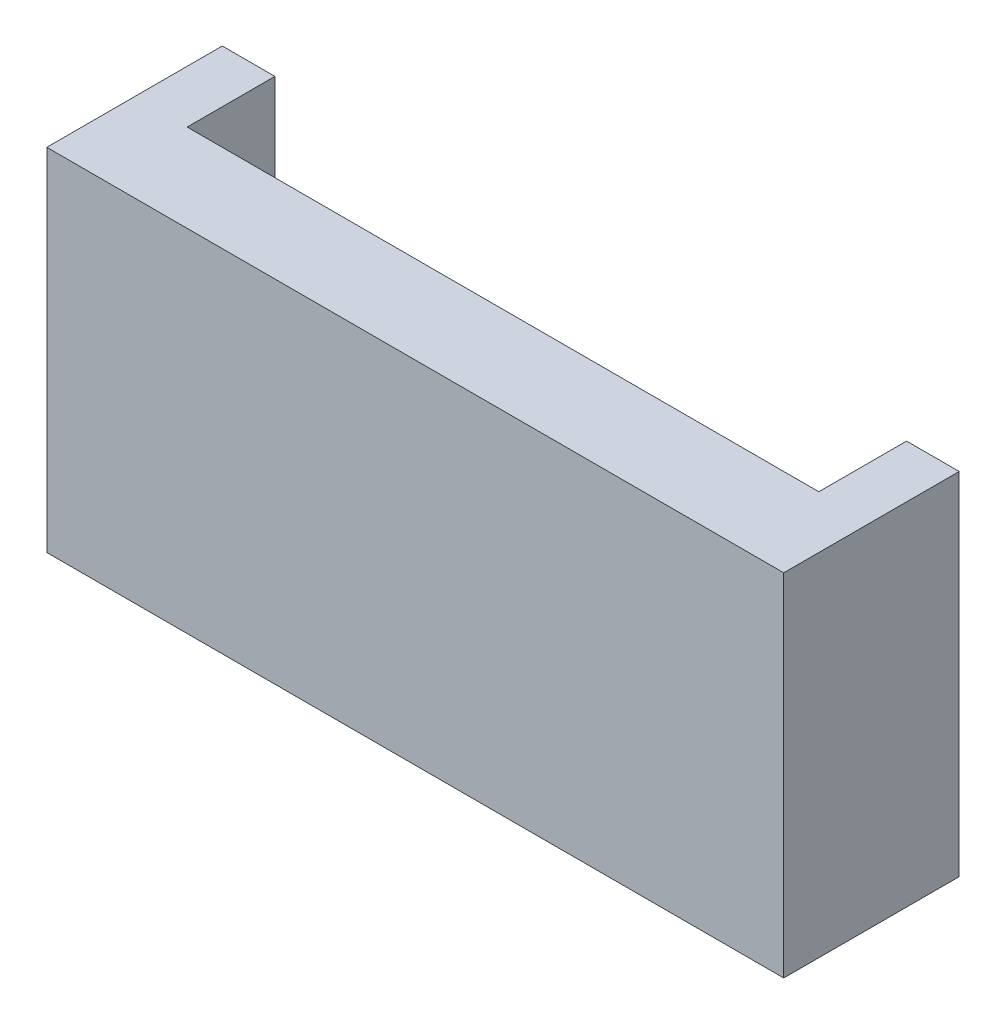
from build123d import *

# Parameters (mm, degrees)
SKETCH1_W           = 18
SKETCH1_H           = 5
BOSS_EXTRUDE1_DEPTH = 1.5
SKETCH2_W           = 18
SKETCH2_H           = 2.5
SKETCH2_W_2         = 5
SKETCH2_H_2         = 1
SKETCH2_W_3         = 4.8
BOSS_EXTRUDE3_DEPTH = 4.5
SKETCH4_W           = 18
SKETCH4_H           = 2.5
BOSS_EXTRUDE4_DEPTH = 4
SKETCH6_W           = 5
SKETCH6_H           = 10
BOSS_EXTRUDE5_DEPTH = 1.5
SKETCH7_W           = 5
SKETCH7_H           = 10
BOSS_EXTRUDE6_DEPTH = 1.5


with BuildPart() as part:
    # Sketch1 → Boss-Extrude1 (new body)
    with BuildSketch(Plane(origin=(0, 0, 0), x_dir=(1, 0, 0), z_dir=(0, 1, 0))):
        with Locations((3.151785714, 0.111607143)):
            Rectangle(SKETCH1_W, SKETCH1_H)
    extrude(amount=BOSS_EXTRUDE1_DEPTH)

    # Sketch2 → Boss-Extrude3 (add)
    with BuildSketch(Plane(origin=(0, 1.5, 0), x_dir=(1, 0, 0), z_dir=(0, 1, 0))):
        with Locations((3.151785714, -1.138392857)):
            Rectangle(SKETCH2_W, SKETCH2_H)
        with Locations((-3.348214286, 2.111607143)):
            Rectangle(SKETCH2_W_2, SKETCH2_H_2)
        with Locations((9.751785714, 2.111607143)):
            Rectangle(SKETCH2_W_3, SKETCH2_H_2)
    extrude(amount=BOSS_EXTRUDE3_DEPTH)

    # Sketch4 → Boss-Extrude4 (add)
    with BuildSketch(Plane(origin=(0, 6, 0), x_dir=(1, 0, 0), z_dir=(0, 1, 0))):
        with Locations((3.151785714, -1.138392857)):
            Rectangle(SKETCH4_W, SKETCH4_H)
    extrude(amount=BOSS_EXTRUDE4_DEPTH)

    # Sketch6 → Boss-Extrude5 (add)
    with BuildSketch(Plane(origin=(12.151785714, 0, 0), x_dir=(0, 0, -1), z_dir=(1, 0, 0))):
        with Locations((0.111607143, 5)):
            Rectangle(SKETCH6_W, SKETCH6_H)
    extrude(amount=BOSS_EXTRUDE5_DEPTH)

    # Sketch7 → Boss-Extrude6 (add)
    with BuildSketch(Plane.ZY.offset(5.848214286)):
        with Locations((-0.111607143, 5)):
            Rectangle(SKETCH7_W, SKETCH7_H)
    extrude(amount=BOSS_EXTRUDE6_DEPTH)


solid = part.part
